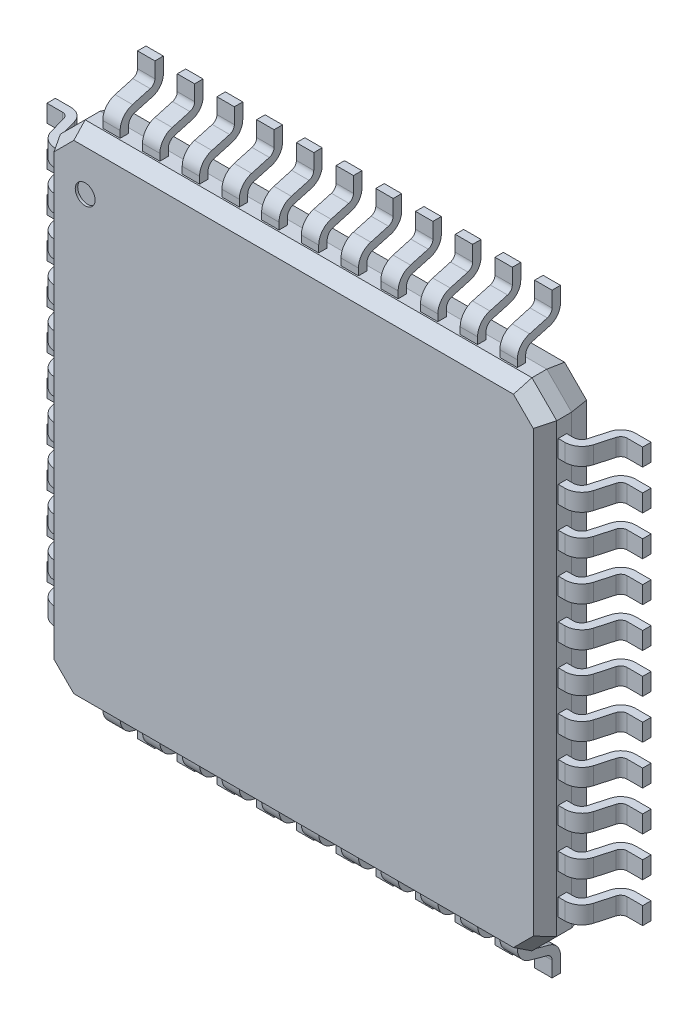
from build123d import *
from OCP.BRepFilletAPI import BRepFilletAPI_MakeChamfer

# Parameters (mm, degrees)
SKETCH_1_W             = 10
SKETCH_1_H             = 10
EXTRUDE_1_DEPTH        = 1
CHAMFER_1_SIZE         = 0.5
CHAMFER_3_SIZE         = 0.3
CHAMFER_3_SIZE2        = 0.173205081
CHAMFER_4_SIZE         = 0.1
CHAMFER_4_SIZE2        = 0.401078093
EXTRUDE_1_2_DEPTH      = 0.175
PATTERN_LINEAR_1_COUNT = 11
PATTERN_LINEAR_1_PITCH = 0.8
EXTRUDE_2_DEPTH        = 0.175
PATTERN_LINEAR_2_COUNT = 11
PATTERN_LINEAR_2_PITCH = 0.8
MIRROR_1_COPY_1_DEPTH  = 0.175
MIRROR_1_COPY_2_DEPTH  = 0.175
MIRROR_1_COPY_3_DEPTH  = 0.175
MIRROR_1_COPY_4_DEPTH  = 0.175
MIRROR_1_COPY_5_DEPTH  = 0.175
MIRROR_1_COPY_6_DEPTH  = 0.175
MIRROR_1_COPY_7_DEPTH  = 0.175
MIRROR_1_COPY_8_DEPTH  = 0.175
MIRROR_1_COPY_9_DEPTH  = 0.175
MIRROR_1_COPY_10_DEPTH = 0.175
MIRROR_2_COPY_1_DEPTH  = 0.175
MIRROR_2_COPY_2_DEPTH  = 0.175
MIRROR_2_COPY_3_DEPTH  = 0.175
MIRROR_2_COPY_4_DEPTH  = 0.175
MIRROR_2_COPY_5_DEPTH  = 0.175
MIRROR_2_COPY_6_DEPTH  = 0.175
MIRROR_2_COPY_7_DEPTH  = 0.175
MIRROR_2_COPY_8_DEPTH  = 0.175
MIRROR_2_COPY_9_DEPTH  = 0.175
MIRROR_2_COPY_10_DEPTH = 0.175
SKETCH_4_R             = 0.2
CUT_EXTRUDE_1_DEPTH    = 0.05
MOVE_BODY_3_ANGLE      = 120


with BuildPart() as part:
    # Эскиз1 → Extrude 1 (new body)
    with BuildSketch(Plane(origin=(0, -0.2, 0), x_dir=(-1, 0, 0), z_dir=(0, 1, 0))):
        Rectangle(SKETCH_1_W, SKETCH_1_H)
    extrude(amount=EXTRUDE_1_DEPTH)

    # Фаска1
    chamfer_1_edges = [part.edges().sort_by_distance(p)[0] for p in [
        (-5, 0.3, -5),
        (5, 0.3, -5),
        (5, 0.3, 5),
        (-5, 0.3, 5),
    ]]
    chamfer(chamfer_1_edges, length=CHAMFER_1_SIZE)

    # Фаска3: one chamfer whose edges measure the first distance from different faces: ONE call of the kernel's chamfer builder (chamfer() names one face for all edges)
    chamfer_3_edges_1 = [part.edges().sort_by_distance(p)[0] for p in [
        (0, 0.8, -5),
    ]]
    chamfer_3_side_1 = [part.faces().sort_by_distance(p)[0] for p in [
        (0, 0.3, -5),
    ]]
    chamfer_3_edges_2 = [part.edges().sort_by_distance(p)[0] for p in [
        (5, 0.8, 0),
    ]]
    chamfer_3_side_2 = [part.faces().sort_by_distance(p)[0] for p in [
        (5, 0.3, 0),
    ]]
    chamfer_3_edges_3 = [part.edges().sort_by_distance(p)[0] for p in [
        (-5, 0.8, 0),
    ]]
    chamfer_3_side_3 = [part.faces().sort_by_distance(p)[0] for p in [
        (-5, 0.3, 0),
    ]]
    chamfer_3_edges_4 = [part.edges().sort_by_distance(p)[0] for p in [
        (0, 0.8, 5),
    ]]
    chamfer_3_side_4 = [part.faces().sort_by_distance(p)[0] for p in [
        (0, 0.3, 5),
    ]]
    chamfer_3_edges_5 = [part.edges().sort_by_distance(p)[0] for p in [
        (-4.75, 0.8, 4.75),
    ]]
    chamfer_3_side_5 = [part.faces().sort_by_distance(p)[0] for p in [
        (-4.75, 0.3, 4.75),
    ]]
    chamfer_3_edges_6 = [part.edges().sort_by_distance(p)[0] for p in [
        (4.75, 0.8, 4.75),
    ]]
    chamfer_3_side_6 = [part.faces().sort_by_distance(p)[0] for p in [
        (4.75, 0.3, 4.75),
    ]]
    chamfer_3_edges_7 = [part.edges().sort_by_distance(p)[0] for p in [
        (-4.75, 0.8, -4.75),
    ]]
    chamfer_3_side_7 = [part.faces().sort_by_distance(p)[0] for p in [
        (-4.75, 0.3, -4.75),
    ]]
    chamfer_3_edges_8 = [part.edges().sort_by_distance(p)[0] for p in [
        (4.75, 0.8, -4.75),
    ]]
    chamfer_3_side_8 = [part.faces().sort_by_distance(p)[0] for p in [
        (4.75, 0.3, -4.75),
    ]]
    chamfer_3 = BRepFilletAPI_MakeChamfer(part.part.solid().wrapped)
    for e in chamfer_3_edges_1:
        chamfer_3.Add(CHAMFER_3_SIZE, CHAMFER_3_SIZE2, e.wrapped, chamfer_3_side_1[0].wrapped)  # the first distance lies on this face
    for e in chamfer_3_edges_2:
        chamfer_3.Add(CHAMFER_3_SIZE, CHAMFER_3_SIZE2, e.wrapped, chamfer_3_side_2[0].wrapped)  # the first distance lies on this face
    for e in chamfer_3_edges_3:
        chamfer_3.Add(CHAMFER_3_SIZE, CHAMFER_3_SIZE2, e.wrapped, chamfer_3_side_3[0].wrapped)  # the first distance lies on this face
    for e in chamfer_3_edges_4:
        chamfer_3.Add(CHAMFER_3_SIZE, CHAMFER_3_SIZE2, e.wrapped, chamfer_3_side_4[0].wrapped)  # the first distance lies on this face
    for e in chamfer_3_edges_5:
        chamfer_3.Add(CHAMFER_3_SIZE, CHAMFER_3_SIZE2, e.wrapped, chamfer_3_side_5[0].wrapped)  # the first distance lies on this face
    for e in chamfer_3_edges_6:
        chamfer_3.Add(CHAMFER_3_SIZE, CHAMFER_3_SIZE2, e.wrapped, chamfer_3_side_6[0].wrapped)  # the first distance lies on this face
    for e in chamfer_3_edges_7:
        chamfer_3.Add(CHAMFER_3_SIZE, CHAMFER_3_SIZE2, e.wrapped, chamfer_3_side_7[0].wrapped)  # the first distance lies on this face
    for e in chamfer_3_edges_8:
        chamfer_3.Add(CHAMFER_3_SIZE, CHAMFER_3_SIZE2, e.wrapped, chamfer_3_side_8[0].wrapped)  # the first distance lies on this face
    add(Compound.cast(chamfer_3.Shape()), mode=Mode.REPLACE)

    # Фаска4
    chamfer_4_edges = [part.edges().sort_by_distance(p)[0] for p in [
        (0, -0.2, -5),
        (-5, -0.2, 0),
        (5, -0.2, 0),
        (0, -0.2, 5),
        (-4.75, -0.2, 4.75),
        (4.75, -0.2, 4.75),
        (-4.75, -0.2, -4.75),
        (4.75, -0.2, -4.75),
    ]]
    chamfer_4_side = [part.faces().sort_by_distance(p)[0] for p in [
        (0, -0.2, 0),
    ]]
    chamfer(chamfer_4_edges, length=CHAMFER_4_SIZE, length2=CHAMFER_4_SIZE2, reference=chamfer_4_side[0])

    # Эскиз2 → Extrude 1 2 (add, symmetric)
    with BuildSketch(Plane(origin=(4, 0, 0), x_dir=(0, 0, -1), z_dir=(1, 0, 0))):
        with BuildLine():
            Line((5, 0.3), (5.136306578, 0.3))
            ThreePointArc((5.136306578, 0.3), (5.239023048, 0.265459687), (5.3, 0.175874432))
            Line((5.3, 0.175874432), (5.4, -0.180954881))
            ThreePointArc((5.4, -0.180954881), (5.507606386, -0.339046506), (5.688870745, -0.4))
            Line((5.688870745, -0.4), (6, -0.4))
            Line((6, -0.4), (6, -0.23))
            Line((6, -0.23), (5.688870745, -0.23))
            ThreePointArc((5.688870745, -0.23), (5.610322856, -0.203586819), (5.563693422, -0.135080448))
            Line((5.563693422, -0.135080448), (5.463693422, 0.221748865))
            ThreePointArc((5.463693422, 0.221748865), (5.341739518, 0.400919374), (5.136306578, 0.47))
            Line((5.136306578, 0.47), (5, 0.47))
            Line((5, 0.47), (5, 0.3))
        make_face()
    extrude_1_2 = extrude(amount=EXTRUDE_1_2_DEPTH, both=True)

    # Линейный массив1: Extrude 1 2 ×11
    with Locations(*[(-i * PATTERN_LINEAR_1_PITCH, 0, 0) for i in range(1, PATTERN_LINEAR_1_COUNT)]):
        add(extrude_1_2)

    # Эскиз3 → Вытянуть-Тонкостенный2 (add, symmetric)
    with BuildSketch(Plane.XY.offset(4)):
        with BuildLine():
            Line((5, 0.3), (5.136306578, 0.3))
            ThreePointArc((5.136306578, 0.3), (5.239023048, 0.265459687), (5.3, 0.175874432))
            Line((5.3, 0.175874432), (5.4, -0.180954881))
            ThreePointArc((5.4, -0.180954881), (5.507606386, -0.339046506), (5.688870745, -0.4))
            Line((5.688870745, -0.4), (6, -0.4))
            Line((6, -0.4), (6, -0.23))
            Line((6, -0.23), (5.688870745, -0.23))
            ThreePointArc((5.688870745, -0.23), (5.610322856, -0.203586819), (5.563693422, -0.135080448))
            Line((5.563693422, -0.135080448), (5.463693422, 0.221748865))
            ThreePointArc((5.463693422, 0.221748865), (5.341739518, 0.400919374), (5.136306578, 0.47))
            Line((5.136306578, 0.47), (5, 0.47))
            Line((5, 0.47), (5, 0.3))
        make_face()
    extrude_2 = extrude(amount=EXTRUDE_2_DEPTH, both=True)

    # Линейный массив2: Вытянуть-Тонкостенный2 ×11
    with Locations(*[(0, 0, -i * PATTERN_LINEAR_2_PITCH) for i in range(1, PATTERN_LINEAR_2_COUNT)]):
        add(extrude_2)

    # Зеркальное отражение1: Extrude 1 2 across plane
    add(extrude_1_2.mirror(Plane.XY))

    # Зеркальное отражение1 copy 1 sketch → Зеркальное отражение1 copy 1 (add, symmetric)
    with BuildSketch(Plane(origin=(3.2, 0, 0), x_dir=(0, 0, 1), z_dir=(1, 0, 0))):
        with BuildLine():
            Line((5, -0.3), (5.136306578, -0.3))
            ThreePointArc((5.136306578, -0.3), (5.239023048, -0.265459687), (5.3, -0.175874432))
            Line((5.3, -0.175874432), (5.4, 0.180954881))
            ThreePointArc((5.4, 0.180954881), (5.507606386, 0.339046506), (5.688870745, 0.4))
            Line((5.688870745, 0.4), (6, 0.4))
            Line((6, 0.4), (6, 0.23))
            Line((6, 0.23), (5.688870745, 0.23))
            ThreePointArc((5.688870745, 0.23), (5.610322856, 0.203586819), (5.563693422, 0.135080448))
            Line((5.563693422, 0.135080448), (5.463693422, -0.221748865))
            ThreePointArc((5.463693422, -0.221748865), (5.341739518, -0.400919374), (5.136306578, -0.47))
            Line((5.136306578, -0.47), (5, -0.47))
            Line((5, -0.47), (5, -0.3))
        make_face()
    extrude(amount=MIRROR_1_COPY_1_DEPTH, both=True)

    # Зеркальное отражение1 copy 2 sketch → Зеркальное отражение1 copy 2 (add, symmetric)
    with BuildSketch(Plane(origin=(2.4, 0, 0), x_dir=(0, 0, 1), z_dir=(1, 0, 0))):
        with BuildLine():
            Line((5, -0.3), (5.136306578, -0.3))
            ThreePointArc((5.136306578, -0.3), (5.239023048, -0.265459687), (5.3, -0.175874432))
            Line((5.3, -0.175874432), (5.4, 0.180954881))
            ThreePointArc((5.4, 0.180954881), (5.507606386, 0.339046506), (5.688870745, 0.4))
            Line((5.688870745, 0.4), (6, 0.4))
            Line((6, 0.4), (6, 0.23))
            Line((6, 0.23), (5.688870745, 0.23))
            ThreePointArc((5.688870745, 0.23), (5.610322856, 0.203586819), (5.563693422, 0.135080448))
            Line((5.563693422, 0.135080448), (5.463693422, -0.221748865))
            ThreePointArc((5.463693422, -0.221748865), (5.341739518, -0.400919374), (5.136306578, -0.47))
            Line((5.136306578, -0.47), (5, -0.47))
            Line((5, -0.47), (5, -0.3))
        make_face()
    extrude(amount=MIRROR_1_COPY_2_DEPTH, both=True)

    # Зеркальное отражение1 copy 3 sketch → Зеркальное отражение1 copy 3 (add, symmetric)
    with BuildSketch(Plane(origin=(1.6, 0, 0), x_dir=(0, 0, 1), z_dir=(1, 0, 0))):
        with BuildLine():
            Line((5, -0.3), (5.136306578, -0.3))
            ThreePointArc((5.136306578, -0.3), (5.239023048, -0.265459687), (5.3, -0.175874432))
            Line((5.3, -0.175874432), (5.4, 0.180954881))
            ThreePointArc((5.4, 0.180954881), (5.507606386, 0.339046506), (5.688870745, 0.4))
            Line((5.688870745, 0.4), (6, 0.4))
            Line((6, 0.4), (6, 0.23))
            Line((6, 0.23), (5.688870745, 0.23))
            ThreePointArc((5.688870745, 0.23), (5.610322856, 0.203586819), (5.563693422, 0.135080448))
            Line((5.563693422, 0.135080448), (5.463693422, -0.221748865))
            ThreePointArc((5.463693422, -0.221748865), (5.341739518, -0.400919374), (5.136306578, -0.47))
            Line((5.136306578, -0.47), (5, -0.47))
            Line((5, -0.47), (5, -0.3))
        make_face()
    extrude(amount=MIRROR_1_COPY_3_DEPTH, both=True)

    # Зеркальное отражение1 copy 4 sketch → Зеркальное отражение1 copy 4 (add, symmetric)
    with BuildSketch(Plane(origin=(0.8, 0, 0), x_dir=(0, 0, 1), z_dir=(1, 0, 0))):
        with BuildLine():
            Line((5, -0.3), (5.136306578, -0.3))
            ThreePointArc((5.136306578, -0.3), (5.239023048, -0.265459687), (5.3, -0.175874432))
            Line((5.3, -0.175874432), (5.4, 0.180954881))
            ThreePointArc((5.4, 0.180954881), (5.507606386, 0.339046506), (5.688870745, 0.4))
            Line((5.688870745, 0.4), (6, 0.4))
            Line((6, 0.4), (6, 0.23))
            Line((6, 0.23), (5.688870745, 0.23))
            ThreePointArc((5.688870745, 0.23), (5.610322856, 0.203586819), (5.563693422, 0.135080448))
            Line((5.563693422, 0.135080448), (5.463693422, -0.221748865))
            ThreePointArc((5.463693422, -0.221748865), (5.341739518, -0.400919374), (5.136306578, -0.47))
            Line((5.136306578, -0.47), (5, -0.47))
            Line((5, -0.47), (5, -0.3))
        make_face()
    extrude(amount=MIRROR_1_COPY_4_DEPTH, both=True)

    # Зеркальное отражение1 copy 5 sketch → Зеркальное отражение1 copy 5 (add, symmetric)
    with BuildSketch(Plane(origin=(0, 0, 0), x_dir=(0, 0, 1), z_dir=(1, 0, 0))):
        with BuildLine():
            Line((5, -0.3), (5.136306578, -0.3))
            ThreePointArc((5.136306578, -0.3), (5.239023048, -0.265459687), (5.3, -0.175874432))
            Line((5.3, -0.175874432), (5.4, 0.180954881))
            ThreePointArc((5.4, 0.180954881), (5.507606386, 0.339046506), (5.688870745, 0.4))
            Line((5.688870745, 0.4), (6, 0.4))
            Line((6, 0.4), (6, 0.23))
            Line((6, 0.23), (5.688870745, 0.23))
            ThreePointArc((5.688870745, 0.23), (5.610322856, 0.203586819), (5.563693422, 0.135080448))
            Line((5.563693422, 0.135080448), (5.463693422, -0.221748865))
            ThreePointArc((5.463693422, -0.221748865), (5.341739518, -0.400919374), (5.136306578, -0.47))
            Line((5.136306578, -0.47), (5, -0.47))
            Line((5, -0.47), (5, -0.3))
        make_face()
    extrude(amount=MIRROR_1_COPY_5_DEPTH, both=True)

    # Зеркальное отражение1 copy 6 sketch → Зеркальное отражение1 copy 6 (add, symmetric)
    with BuildSketch(Plane(origin=(-0.8, 0, 0), x_dir=(0, 0, 1), z_dir=(1, 0, 0))):
        with BuildLine():
            Line((5, -0.3), (5.136306578, -0.3))
            ThreePointArc((5.136306578, -0.3), (5.239023048, -0.265459687), (5.3, -0.175874432))
            Line((5.3, -0.175874432), (5.4, 0.180954881))
            ThreePointArc((5.4, 0.180954881), (5.507606386, 0.339046506), (5.688870745, 0.4))
            Line((5.688870745, 0.4), (6, 0.4))
            Line((6, 0.4), (6, 0.23))
            Line((6, 0.23), (5.688870745, 0.23))
            ThreePointArc((5.688870745, 0.23), (5.610322856, 0.203586819), (5.563693422, 0.135080448))
            Line((5.563693422, 0.135080448), (5.463693422, -0.221748865))
            ThreePointArc((5.463693422, -0.221748865), (5.341739518, -0.400919374), (5.136306578, -0.47))
            Line((5.136306578, -0.47), (5, -0.47))
            Line((5, -0.47), (5, -0.3))
        make_face()
    extrude(amount=MIRROR_1_COPY_6_DEPTH, both=True)

    # Зеркальное отражение1 copy 7 sketch → Зеркальное отражение1 copy 7 (add, symmetric)
    with BuildSketch(Plane(origin=(-1.6, 0, 0), x_dir=(0, 0, 1), z_dir=(1, 0, 0))):
        with BuildLine():
            Line((5, -0.3), (5.136306578, -0.3))
            ThreePointArc((5.136306578, -0.3), (5.239023048, -0.265459687), (5.3, -0.175874432))
            Line((5.3, -0.175874432), (5.4, 0.180954881))
            ThreePointArc((5.4, 0.180954881), (5.507606386, 0.339046506), (5.688870745, 0.4))
            Line((5.688870745, 0.4), (6, 0.4))
            Line((6, 0.4), (6, 0.23))
            Line((6, 0.23), (5.688870745, 0.23))
            ThreePointArc((5.688870745, 0.23), (5.610322856, 0.203586819), (5.563693422, 0.135080448))
            Line((5.563693422, 0.135080448), (5.463693422, -0.221748865))
            ThreePointArc((5.463693422, -0.221748865), (5.341739518, -0.400919374), (5.136306578, -0.47))
            Line((5.136306578, -0.47), (5, -0.47))
            Line((5, -0.47), (5, -0.3))
        make_face()
    extrude(amount=MIRROR_1_COPY_7_DEPTH, both=True)

    # Зеркальное отражение1 copy 8 sketch → Зеркальное отражение1 copy 8 (add, symmetric)
    with BuildSketch(Plane(origin=(-2.4, 0, 0), x_dir=(0, 0, 1), z_dir=(1, 0, 0))):
        with BuildLine():
            Line((5, -0.3), (5.136306578, -0.3))
            ThreePointArc((5.136306578, -0.3), (5.239023048, -0.265459687), (5.3, -0.175874432))
            Line((5.3, -0.175874432), (5.4, 0.180954881))
            ThreePointArc((5.4, 0.180954881), (5.507606386, 0.339046506), (5.688870745, 0.4))
            Line((5.688870745, 0.4), (6, 0.4))
            Line((6, 0.4), (6, 0.23))
            Line((6, 0.23), (5.688870745, 0.23))
            ThreePointArc((5.688870745, 0.23), (5.610322856, 0.203586819), (5.563693422, 0.135080448))
            Line((5.563693422, 0.135080448), (5.463693422, -0.221748865))
            ThreePointArc((5.463693422, -0.221748865), (5.341739518, -0.400919374), (5.136306578, -0.47))
            Line((5.136306578, -0.47), (5, -0.47))
            Line((5, -0.47), (5, -0.3))
        make_face()
    extrude(amount=MIRROR_1_COPY_8_DEPTH, both=True)

    # Зеркальное отражение1 copy 9 sketch → Зеркальное отражение1 copy 9 (add, symmetric)
    with BuildSketch(Plane(origin=(-3.2, 0, 0), x_dir=(0, 0, 1), z_dir=(1, 0, 0))):
        with BuildLine():
            Line((5, -0.3), (5.136306578, -0.3))
            ThreePointArc((5.136306578, -0.3), (5.239023048, -0.265459687), (5.3, -0.175874432))
            Line((5.3, -0.175874432), (5.4, 0.180954881))
            ThreePointArc((5.4, 0.180954881), (5.507606386, 0.339046506), (5.688870745, 0.4))
            Line((5.688870745, 0.4), (6, 0.4))
            Line((6, 0.4), (6, 0.23))
            Line((6, 0.23), (5.688870745, 0.23))
            ThreePointArc((5.688870745, 0.23), (5.610322856, 0.203586819), (5.563693422, 0.135080448))
            Line((5.563693422, 0.135080448), (5.463693422, -0.221748865))
            ThreePointArc((5.463693422, -0.221748865), (5.341739518, -0.400919374), (5.136306578, -0.47))
            Line((5.136306578, -0.47), (5, -0.47))
            Line((5, -0.47), (5, -0.3))
        make_face()
    extrude(amount=MIRROR_1_COPY_9_DEPTH, both=True)

    # Зеркальное отражение1 copy 10 sketch → Зеркальное отражение1 copy 10 (add, symmetric)
    with BuildSketch(Plane(origin=(-4, 0, 0), x_dir=(0, 0, 1), z_dir=(1, 0, 0))):
        with BuildLine():
            Line((5, -0.3), (5.136306578, -0.3))
            ThreePointArc((5.136306578, -0.3), (5.239023048, -0.265459687), (5.3, -0.175874432))
            Line((5.3, -0.175874432), (5.4, 0.180954881))
            ThreePointArc((5.4, 0.180954881), (5.507606386, 0.339046506), (5.688870745, 0.4))
            Line((5.688870745, 0.4), (6, 0.4))
            Line((6, 0.4), (6, 0.23))
            Line((6, 0.23), (5.688870745, 0.23))
            ThreePointArc((5.688870745, 0.23), (5.610322856, 0.203586819), (5.563693422, 0.135080448))
            Line((5.563693422, 0.135080448), (5.463693422, -0.221748865))
            ThreePointArc((5.463693422, -0.221748865), (5.341739518, -0.400919374), (5.136306578, -0.47))
            Line((5.136306578, -0.47), (5, -0.47))
            Line((5, -0.47), (5, -0.3))
        make_face()
    extrude(amount=MIRROR_1_COPY_10_DEPTH, both=True)

    # Зеркальное отражение2: Вытянуть-Тонкостенный2 across plane
    add(extrude_2.mirror(Plane(origin=(0, 0, 0), x_dir=(0, 0, 1), z_dir=(1, 0, 0))))

    # Зеркальное отражение2 copy 1 sketch → Зеркальное отражение2 copy 1 (add, symmetric)
    with BuildSketch(Plane(origin=(0, 0, 3.2), x_dir=(-1, 0, 0), z_dir=(0, 0, 1))):
        with BuildLine():
            Line((5, -0.3), (5.136306578, -0.3))
            ThreePointArc((5.136306578, -0.3), (5.239023048, -0.265459687), (5.3, -0.175874432))
            Line((5.3, -0.175874432), (5.4, 0.180954881))
            ThreePointArc((5.4, 0.180954881), (5.507606386, 0.339046506), (5.688870745, 0.4))
            Line((5.688870745, 0.4), (6, 0.4))
            Line((6, 0.4), (6, 0.23))
            Line((6, 0.23), (5.688870745, 0.23))
            ThreePointArc((5.688870745, 0.23), (5.610322856, 0.203586819), (5.563693422, 0.135080448))
            Line((5.563693422, 0.135080448), (5.463693422, -0.221748865))
            ThreePointArc((5.463693422, -0.221748865), (5.341739518, -0.400919374), (5.136306578, -0.47))
            Line((5.136306578, -0.47), (5, -0.47))
            Line((5, -0.47), (5, -0.3))
        make_face()
    extrude(amount=MIRROR_2_COPY_1_DEPTH, both=True)

    # Зеркальное отражение2 copy 2 sketch → Зеркальное отражение2 copy 2 (add, symmetric)
    with BuildSketch(Plane(origin=(0, 0, 2.4), x_dir=(-1, 0, 0), z_dir=(0, 0, 1))):
        with BuildLine():
            Line((5, -0.3), (5.136306578, -0.3))
            ThreePointArc((5.136306578, -0.3), (5.239023048, -0.265459687), (5.3, -0.175874432))
            Line((5.3, -0.175874432), (5.4, 0.180954881))
            ThreePointArc((5.4, 0.180954881), (5.507606386, 0.339046506), (5.688870745, 0.4))
            Line((5.688870745, 0.4), (6, 0.4))
            Line((6, 0.4), (6, 0.23))
            Line((6, 0.23), (5.688870745, 0.23))
            ThreePointArc((5.688870745, 0.23), (5.610322856, 0.203586819), (5.563693422, 0.135080448))
            Line((5.563693422, 0.135080448), (5.463693422, -0.221748865))
            ThreePointArc((5.463693422, -0.221748865), (5.341739518, -0.400919374), (5.136306578, -0.47))
            Line((5.136306578, -0.47), (5, -0.47))
            Line((5, -0.47), (5, -0.3))
        make_face()
    extrude(amount=MIRROR_2_COPY_2_DEPTH, both=True)

    # Зеркальное отражение2 copy 3 sketch → Зеркальное отражение2 copy 3 (add, symmetric)
    with BuildSketch(Plane(origin=(0, 0, 1.6), x_dir=(-1, 0, 0), z_dir=(0, 0, 1))):
        with BuildLine():
            Line((5, -0.3), (5.136306578, -0.3))
            ThreePointArc((5.136306578, -0.3), (5.239023048, -0.265459687), (5.3, -0.175874432))
            Line((5.3, -0.175874432), (5.4, 0.180954881))
            ThreePointArc((5.4, 0.180954881), (5.507606386, 0.339046506), (5.688870745, 0.4))
            Line((5.688870745, 0.4), (6, 0.4))
            Line((6, 0.4), (6, 0.23))
            Line((6, 0.23), (5.688870745, 0.23))
            ThreePointArc((5.688870745, 0.23), (5.610322856, 0.203586819), (5.563693422, 0.135080448))
            Line((5.563693422, 0.135080448), (5.463693422, -0.221748865))
            ThreePointArc((5.463693422, -0.221748865), (5.341739518, -0.400919374), (5.136306578, -0.47))
            Line((5.136306578, -0.47), (5, -0.47))
            Line((5, -0.47), (5, -0.3))
        make_face()
    extrude(amount=MIRROR_2_COPY_3_DEPTH, both=True)

    # Зеркальное отражение2 copy 4 sketch → Зеркальное отражение2 copy 4 (add, symmetric)
    with BuildSketch(Plane(origin=(0, 0, 0.8), x_dir=(-1, 0, 0), z_dir=(0, 0, 1))):
        with BuildLine():
            Line((5, -0.3), (5.136306578, -0.3))
            ThreePointArc((5.136306578, -0.3), (5.239023048, -0.265459687), (5.3, -0.175874432))
            Line((5.3, -0.175874432), (5.4, 0.180954881))
            ThreePointArc((5.4, 0.180954881), (5.507606386, 0.339046506), (5.688870745, 0.4))
            Line((5.688870745, 0.4), (6, 0.4))
            Line((6, 0.4), (6, 0.23))
            Line((6, 0.23), (5.688870745, 0.23))
            ThreePointArc((5.688870745, 0.23), (5.610322856, 0.203586819), (5.563693422, 0.135080448))
            Line((5.563693422, 0.135080448), (5.463693422, -0.221748865))
            ThreePointArc((5.463693422, -0.221748865), (5.341739518, -0.400919374), (5.136306578, -0.47))
            Line((5.136306578, -0.47), (5, -0.47))
            Line((5, -0.47), (5, -0.3))
        make_face()
    extrude(amount=MIRROR_2_COPY_4_DEPTH, both=True)

    # Зеркальное отражение2 copy 5 sketch → Зеркальное отражение2 copy 5 (add, symmetric)
    with BuildSketch(Plane(origin=(0, 0, 0), x_dir=(-1, 0, 0), z_dir=(0, 0, 1))):
        with BuildLine():
            Line((5, -0.3), (5.136306578, -0.3))
            ThreePointArc((5.136306578, -0.3), (5.239023048, -0.265459687), (5.3, -0.175874432))
            Line((5.3, -0.175874432), (5.4, 0.180954881))
            ThreePointArc((5.4, 0.180954881), (5.507606386, 0.339046506), (5.688870745, 0.4))
            Line((5.688870745, 0.4), (6, 0.4))
            Line((6, 0.4), (6, 0.23))
            Line((6, 0.23), (5.688870745, 0.23))
            ThreePointArc((5.688870745, 0.23), (5.610322856, 0.203586819), (5.563693422, 0.135080448))
            Line((5.563693422, 0.135080448), (5.463693422, -0.221748865))
            ThreePointArc((5.463693422, -0.221748865), (5.341739518, -0.400919374), (5.136306578, -0.47))
            Line((5.136306578, -0.47), (5, -0.47))
            Line((5, -0.47), (5, -0.3))
        make_face()
    extrude(amount=MIRROR_2_COPY_5_DEPTH, both=True)

    # Зеркальное отражение2 copy 6 sketch → Зеркальное отражение2 copy 6 (add, symmetric)
    with BuildSketch(Plane(origin=(0, 0, -0.8), x_dir=(-1, 0, 0), z_dir=(0, 0, 1))):
        with BuildLine():
            Line((5, -0.3), (5.136306578, -0.3))
            ThreePointArc((5.136306578, -0.3), (5.239023048, -0.265459687), (5.3, -0.175874432))
            Line((5.3, -0.175874432), (5.4, 0.180954881))
            ThreePointArc((5.4, 0.180954881), (5.507606386, 0.339046506), (5.688870745, 0.4))
            Line((5.688870745, 0.4), (6, 0.4))
            Line((6, 0.4), (6, 0.23))
            Line((6, 0.23), (5.688870745, 0.23))
            ThreePointArc((5.688870745, 0.23), (5.610322856, 0.203586819), (5.563693422, 0.135080448))
            Line((5.563693422, 0.135080448), (5.463693422, -0.221748865))
            ThreePointArc((5.463693422, -0.221748865), (5.341739518, -0.400919374), (5.136306578, -0.47))
            Line((5.136306578, -0.47), (5, -0.47))
            Line((5, -0.47), (5, -0.3))
        make_face()
    extrude(amount=MIRROR_2_COPY_6_DEPTH, both=True)

    # Зеркальное отражение2 copy 7 sketch → Зеркальное отражение2 copy 7 (add, symmetric)
    with BuildSketch(Plane(origin=(0, 0, -1.6), x_dir=(-1, 0, 0), z_dir=(0, 0, 1))):
        with BuildLine():
            Line((5, -0.3), (5.136306578, -0.3))
            ThreePointArc((5.136306578, -0.3), (5.239023048, -0.265459687), (5.3, -0.175874432))
            Line((5.3, -0.175874432), (5.4, 0.180954881))
            ThreePointArc((5.4, 0.180954881), (5.507606386, 0.339046506), (5.688870745, 0.4))
            Line((5.688870745, 0.4), (6, 0.4))
            Line((6, 0.4), (6, 0.23))
            Line((6, 0.23), (5.688870745, 0.23))
            ThreePointArc((5.688870745, 0.23), (5.610322856, 0.203586819), (5.563693422, 0.135080448))
            Line((5.563693422, 0.135080448), (5.463693422, -0.221748865))
            ThreePointArc((5.463693422, -0.221748865), (5.341739518, -0.400919374), (5.136306578, -0.47))
            Line((5.136306578, -0.47), (5, -0.47))
            Line((5, -0.47), (5, -0.3))
        make_face()
    extrude(amount=MIRROR_2_COPY_7_DEPTH, both=True)

    # Зеркальное отражение2 copy 8 sketch → Зеркальное отражение2 copy 8 (add, symmetric)
    with BuildSketch(Plane(origin=(0, 0, -2.4), x_dir=(-1, 0, 0), z_dir=(0, 0, 1))):
        with BuildLine():
            Line((5, -0.3), (5.136306578, -0.3))
            ThreePointArc((5.136306578, -0.3), (5.239023048, -0.265459687), (5.3, -0.175874432))
            Line((5.3, -0.175874432), (5.4, 0.180954881))
            ThreePointArc((5.4, 0.180954881), (5.507606386, 0.339046506), (5.688870745, 0.4))
            Line((5.688870745, 0.4), (6, 0.4))
            Line((6, 0.4), (6, 0.23))
            Line((6, 0.23), (5.688870745, 0.23))
            ThreePointArc((5.688870745, 0.23), (5.610322856, 0.203586819), (5.563693422, 0.135080448))
            Line((5.563693422, 0.135080448), (5.463693422, -0.221748865))
            ThreePointArc((5.463693422, -0.221748865), (5.341739518, -0.400919374), (5.136306578, -0.47))
            Line((5.136306578, -0.47), (5, -0.47))
            Line((5, -0.47), (5, -0.3))
        make_face()
    extrude(amount=MIRROR_2_COPY_8_DEPTH, both=True)

    # Зеркальное отражение2 copy 9 sketch → Зеркальное отражение2 copy 9 (add, symmetric)
    with BuildSketch(Plane(origin=(0, 0, -3.2), x_dir=(-1, 0, 0), z_dir=(0, 0, 1))):
        with BuildLine():
            Line((5, -0.3), (5.136306578, -0.3))
            ThreePointArc((5.136306578, -0.3), (5.239023048, -0.265459687), (5.3, -0.175874432))
            Line((5.3, -0.175874432), (5.4, 0.180954881))
            ThreePointArc((5.4, 0.180954881), (5.507606386, 0.339046506), (5.688870745, 0.4))
            Line((5.688870745, 0.4), (6, 0.4))
            Line((6, 0.4), (6, 0.23))
            Line((6, 0.23), (5.688870745, 0.23))
            ThreePointArc((5.688870745, 0.23), (5.610322856, 0.203586819), (5.563693422, 0.135080448))
            Line((5.563693422, 0.135080448), (5.463693422, -0.221748865))
            ThreePointArc((5.463693422, -0.221748865), (5.341739518, -0.400919374), (5.136306578, -0.47))
            Line((5.136306578, -0.47), (5, -0.47))
            Line((5, -0.47), (5, -0.3))
        make_face()
    extrude(amount=MIRROR_2_COPY_9_DEPTH, both=True)

    # Зеркальное отражение2 copy 10 sketch → Зеркальное отражение2 copy 10 (add, symmetric)
    with BuildSketch(Plane(origin=(0, 0, -4), x_dir=(-1, 0, 0), z_dir=(0, 0, 1))):
        with BuildLine():
            Line((5, -0.3), (5.136306578, -0.3))
            ThreePointArc((5.136306578, -0.3), (5.239023048, -0.265459687), (5.3, -0.175874432))
            Line((5.3, -0.175874432), (5.4, 0.180954881))
            ThreePointArc((5.4, 0.180954881), (5.507606386, 0.339046506), (5.688870745, 0.4))
            Line((5.688870745, 0.4), (6, 0.4))
            Line((6, 0.4), (6, 0.23))
            Line((6, 0.23), (5.688870745, 0.23))
            ThreePointArc((5.688870745, 0.23), (5.610322856, 0.203586819), (5.563693422, 0.135080448))
            Line((5.563693422, 0.135080448), (5.463693422, -0.221748865))
            ThreePointArc((5.463693422, -0.221748865), (5.341739518, -0.400919374), (5.136306578, -0.47))
            Line((5.136306578, -0.47), (5, -0.47))
            Line((5, -0.47), (5, -0.3))
        make_face()
    extrude(amount=MIRROR_2_COPY_10_DEPTH, both=True)

    # Эскиз4 → Вырез-Вытянуть1 (cut)
    with BuildSketch(Plane(origin=(0, 0.8, 0), x_dir=(1, 0, 0), z_dir=(0, 1, 0))):
        with Locations(Location((-4, -4.2, 0), (0, 0, 270))):
            Circle(SKETCH_4_R)
    extrude(amount=-CUT_EXTRUDE_1_DEPTH, mode=Mode.SUBTRACT)


with BuildPart() as part_1:
    # Move Body 3: read off the stored shape, not the designer's step
    # Move Body 3: moved
    add(part.part.moved(Location((4, 0.4, -5.845))).rotate(Axis((0, 0, 0), (0.5773502692, -0.5773502692, -0.5773502692)), MOVE_BODY_3_ANGLE))


solid = part_1.part
